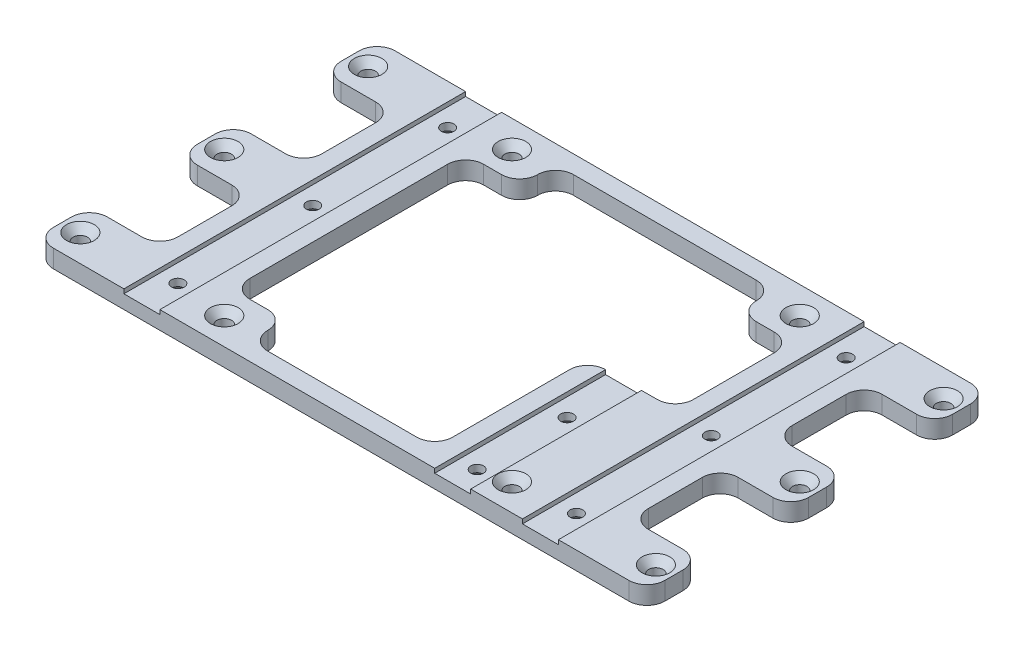
from build123d import *

# Parameters (mm, degrees)
SKETCH1_W                                       = 215.9
SKETCH1_H                                       = 120.65
BOSS_EXTRUDE1_DEPTH                             = 6.35
CSK_FOR_10_FLAT_HEAD_MACHINE_SCREW1_D           = 5.1054
CSK_FOR_10_FLAT_HEAD_MACHINE_SCREW1_CSINK_D     = 9.779
CSK_FOR_10_FLAT_HEAD_MACHINE_SCREW1_CSINK_ANGLE = 82
CSK_FOR_8_FLAT_HEAD_MACHINE_SCREW1_D            = 4.4958
CSK_FOR_8_FLAT_HEAD_MACHINE_SCREW1_CSINK_D      = 8.4328
CSK_FOR_8_FLAT_HEAD_MACHINE_SCREW1_CSINK_ANGLE  = 82
CSK_FOR_8_FLAT_HEAD_MACHINE_SCREW2_D            = 4.4958
CSK_FOR_8_FLAT_HEAD_MACHINE_SCREW2_CSINK_D      = 8.4328
CSK_FOR_8_FLAT_HEAD_MACHINE_SCREW2_CSINK_ANGLE  = 82
SKETCH10_W                                      = 12.7
SKETCH10_H                                      = 120.65
SKETCH10_H_2                                    = 63.5
CUT_EXTRUDE1_DEPTH                              = 1.524
SKETCH13_W                                      = 24.892
SKETCH13_H                                      = 31.75
CUT_EXTRUDE2_DEPTH                              = 248.405648682
FILLET2_R                                       = 6.35
SKETCH14_W                                      = 12.7
SKETCH14_H                                      = 3.175
CUT_EXTRUDE4_DEPTH                              = 248.405648682
FILLET4_R                                       = 6.35


with BuildPart() as part:
    # Sketch1 → Boss-Extrude1 (new body)
    with BuildSketch(Plane(origin=(0, 0, 0), x_dir=(1, 0, 0), z_dir=(0, 1, 0))):
        with Locations((107.95, 60.325)):
            Rectangle(SKETCH1_W, SKETCH1_H)
    extrude(amount=BOSS_EXTRUDE1_DEPTH)

    # CSK for #10 Flat Head Machine Screw1 (through all)
    with Locations(Plane(origin=(0, 6.35, 0), x_dir=(-1, 0, 0), z_dir=(0, 1, 0))):
        with Locations((-6.35, -111.125), (-209.55, -111.125), (-209.55, -9.525), (-6.35, -9.525), (-6.35, -60.325), (-209.55, -60.325), (-158.75, -111.125), (-57.15, -111.125), (-57.15, -9.525), (-158.75, -9.525)):
            CounterSinkHole(CSK_FOR_10_FLAT_HEAD_MACHINE_SCREW1_D / 2, CSK_FOR_10_FLAT_HEAD_MACHINE_SCREW1_CSINK_D / 2, counter_sink_angle=CSK_FOR_10_FLAT_HEAD_MACHINE_SCREW1_CSINK_ANGLE)

    # CSK for #8 Flat Head Machine Screw1 (through all)
    with Locations(Plane.XZ):
        with Locations((37.592, -12.7), (37.592, -60.325), (37.592, -107.95)):
            csk_for_8_flat_head_machine_screw1 = CounterSinkHole(CSK_FOR_8_FLAT_HEAD_MACHINE_SCREW1_D / 2, CSK_FOR_8_FLAT_HEAD_MACHINE_SCREW1_CSINK_D / 2, counter_sink_angle=CSK_FOR_8_FLAT_HEAD_MACHINE_SCREW1_CSINK_ANGLE)

    # Mirror1: CSK for #8 Flat Head Machine Screw1 across plane
    add(csk_for_8_flat_head_machine_screw1.mirror(Plane.ZY.offset(-107.95)), mode=Mode.SUBTRACT)

    # CSK for #8 Flat Head Machine Screw2 (through all)
    with Locations(Plane.XZ):
        with Locations((147.335875, -8.636), (147.335875, -40.386)):
            CounterSinkHole(CSK_FOR_8_FLAT_HEAD_MACHINE_SCREW2_D / 2, CSK_FOR_8_FLAT_HEAD_MACHINE_SCREW2_CSINK_D / 2, counter_sink_angle=CSK_FOR_8_FLAT_HEAD_MACHINE_SCREW2_CSINK_ANGLE)

    # Sketch10 → Cut-Extrude1 (cut)
    with BuildSketch(Plane(origin=(0, 6.35, 0), x_dir=(1, 0, 0), z_dir=(0, 1, 0))):
        with Locations((37.592, 60.325)):
            Rectangle(SKETCH10_W, SKETCH10_H)
        with Locations((178.308, 60.325)):
            Rectangle(SKETCH10_W, SKETCH10_H)
        with Locations((147.335875, 31.75)):
            Rectangle(SKETCH10_W, SKETCH10_H_2)
    extrude(amount=-CUT_EXTRUDE1_DEPTH, mode=Mode.SUBTRACT)

    # Sketch13 → Cut-Extrude2 (cut, through all)
    with BuildSketch(Plane(origin=(0, 6.35, 0), x_dir=(1, 0, 0), z_dir=(0, 1, 0))):
        with Locations((12.446, 85.725)):
            Rectangle(SKETCH13_W, SKETCH13_H)
        with Locations((12.446, 34.925)):
            Rectangle(SKETCH13_W, SKETCH13_H)
    cut_extrude2 = extrude(amount=-CUT_EXTRUDE2_DEPTH, mode=Mode.SUBTRACT)

    # Mirror4: Cut-Extrude2 across plane
    add(cut_extrude2.mirror(Plane.ZY.offset(-107.95)), mode=Mode.SUBTRACT)

    # Fillet2
    fillet2_edges = [part.edges().sort_by_distance(p)[0] for p in [
        (0, 3.175, -69.85),
        (0, 3.175, -101.6),
        (24.892, 3.175, -101.6),
        (24.892, 3.175, -69.85),
        (0, 3.175, -19.05),
        (0, 3.175, -50.8),
        (24.892, 3.175, -50.8),
        (24.892, 3.175, -19.05),
        (215.9, 3.175, -101.6),
        (215.9, 3.175, -69.85),
        (191.008, 3.175, -69.85),
        (191.008, 3.175, -101.6),
        (215.9, 3.175, -50.8),
        (215.9, 3.175, -19.05),
        (191.008, 3.175, -19.05),
        (191.008, 3.175, -50.8),
        (0, 3.175, -120.65),
        (215.9, 3.175, -120.65),
        (215.9, 3.175, 0),
        (0, 3.175, 0),
    ]]
    fillet(fillet2_edges, radius=FILLET2_R)

    # Sketch14 → Cut-Extrude4 (cut, through all)
    with BuildSketch(Plane(origin=(0, 6.35, 0), x_dir=(1, 0, 0), z_dir=(0, 1, 0))):
        Polygon((146.558, 114.3), (69.342, 114.3), (69.342, 101.6), (50.292, 101.6), (50.292, 19.05), (69.342, 19.05), (69.342, 6.35), (134.635875, 6.35), (134.635875, 19.05), (134.635875, 60.325), (140.985875, 60.325), (140.985875, 63.5), (153.685875, 63.5), (153.685875, 60.325), (165.608, 60.325), (165.608, 101.6), (146.558, 101.6), align=None)
        with Locations((147.335875, 61.9125)):
            Rectangle(SKETCH14_W, SKETCH14_H)
    extrude(amount=-CUT_EXTRUDE4_DEPTH, mode=Mode.SUBTRACT)

    # Fillet4
    fillet4_edges = [part.edges().sort_by_distance(p)[0] for p in [
        (165.608, 3.175, -101.6),
        (134.635875, 3.175, -6.35),
        (69.342, 3.175, -6.35),
        (50.292, 3.175, -19.05),
        (50.292, 3.175, -101.6),
        (69.342, 3.175, -114.3),
        (146.558, 3.175, -114.3),
        (69.342, 3.175, -19.05),
        (69.342, 3.175, -101.6),
        (146.558, 3.175, -101.6),
        (165.608, 3.175, -60.325),
        (134.635875, 3.175, -60.325),
    ]]
    fillet(fillet4_edges, radius=FILLET4_R - 0.0001)  # a hair under: the kernel refuses the full size


solid = part.part
